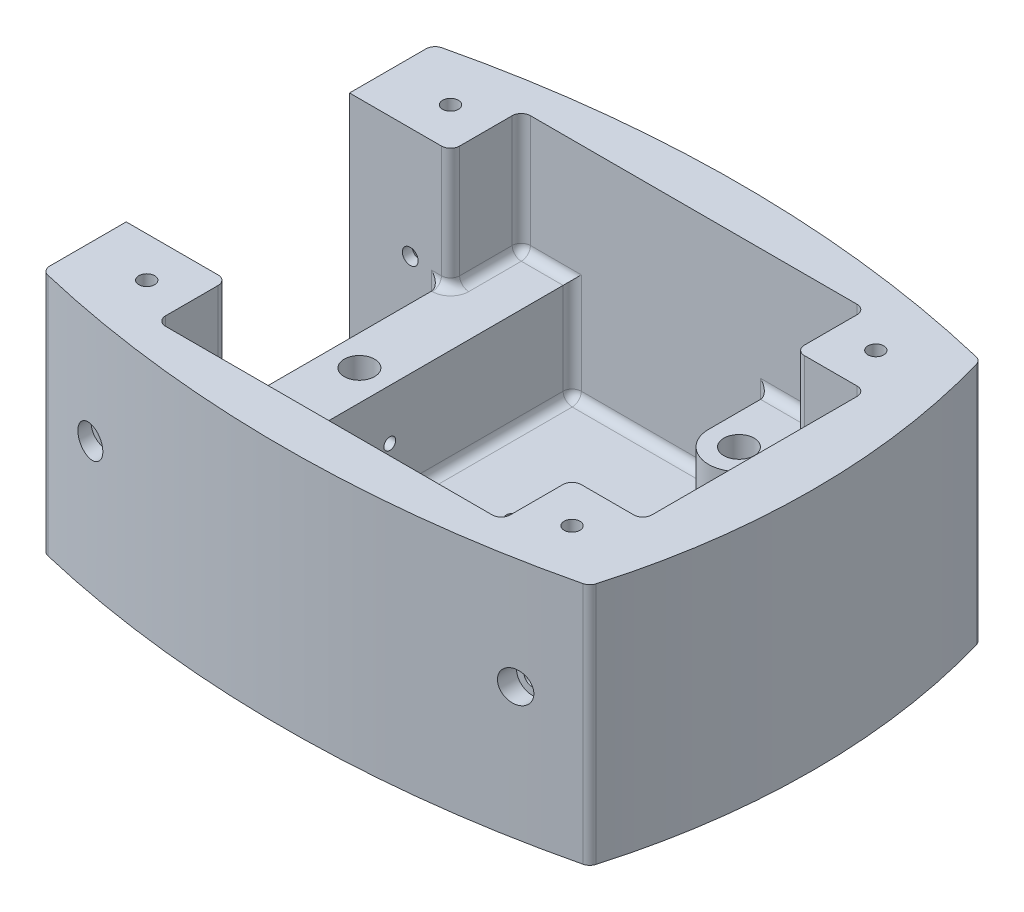
from build123d import *

# Parameters (mm, degrees)
SKETCH1_W            = 20.1
SKETCH1_H            = 20.1
BOSS_EXTRUDE1_DEPTH  = 80
SKETCH1_7_R          = 5
SKETCH1_7_R_2        = 1.6
SKETCH1_7_R_3        = 14
BOSS_EXTRUDE9_DEPTH  = 6.825
SKETCH2_R            = 5.05
CUT_EXTRUDE1_DEPTH   = 62
SKETCH2_3_R          = 5.05
SKETCH2_3_R_2        = 2.6
BOSS_EXTRUDE5_DEPTH  = 26.5
SKETCH2_4_R          = 5.05
SKETCH2_4_R_2        = 2.6
CUT_EXTRUDE2_DEPTH   = 23.3
SKETCH2_5_R          = 5.05
SKETCH2_5_R_2        = 2.6
BOSS_EXTRUDE6_DEPTH  = 3.2
CUT_EXTRUDE3_START   = 127.2
SKETCH2_6_R          = 5.05
CUT_EXTRUDE3_DEPTH   = 127.2
BOSS_EXTRUDE7_START  = 100
SKETCH2_7_R          = 5.05
SKETCH2_7_R_2        = 2.6
BOSS_EXTRUDE7_DEPTH  = 100
CUT_EXTRUDE4_START   = 96.8
SKETCH2_8_R          = 5.05
SKETCH2_8_R_2        = 2.6
CUT_EXTRUDE4_DEPTH   = 96.8
BOSS_EXTRUDE8_START  = 76.7
SKETCH2_9_R          = 5.05
SKETCH2_9_R_2        = 2.6
BOSS_EXTRUDE8_DEPTH  = 76.7
CUT_EXTRUDE5_START   = 73.5
SKETCH2_10_R         = 5.05
SKETCH2_10_R_2       = 2.6
CUT_EXTRUDE5_DEPTH   = 73.5
SKETCH1_9_W          = 20.1
SKETCH1_9_H          = 20.1
SKETCH1_9_R          = 2.6
BOSS_EXTRUDE10_DEPTH = 80
SKETCH1_10_W         = 20.1
SKETCH1_10_H         = 20.1
CUT_EXTRUDE7_DEPTH   = 61.9
SKETCH1_11_R         = 5
BOSS_EXTRUDE11_DEPTH = 40
SKETCH3_R            = 1.95
CUT_EXTRUDE10_DEPTH  = 20
SKETCH3_3_R          = 1.95
CUT_EXTRUDE11_DEPTH  = 118
FILLET1_R            = 3
SKETCH4_R            = 1.5
CUT_EXTRUDE12_DEPTH  = 10


with BuildPart() as part:
    # Sketch1 → Boss-Extrude1 (new body)
    with BuildSketch(Plane(origin=(0, 0, 0), x_dir=(1, 0, 0), z_dir=(0, 1, 0))):
        with BuildLine():
            Line((-126.75, -13.25), (-126.75, 10.05))
            Line((-126.75, 10.05), (-110, 10.05))
            Line((-110, 10.05), (-45, 10.05))
            Line((-45, 10.05), (-25, 10.05))
            Line((-25, 10.05), (-13.25, 10.05))
            Line((-13.25, 10.05), (-13.25, -13.25))
            Line((-13.25, -13.25), (10.05, -13.25))
            Line((10.05, -13.25), (10.05, -86.75))
            Line((10.05, -86.75), (-13.25, -86.75))
            Line((-13.25, -86.75), (-13.25, -110.05))
            Line((-13.25, -110.05), (-25, -110.05))
            Line((-25, -110.05), (-45, -110.05))
            Line((-45, -110.05), (-110, -110.05))
            Line((-110, -110.05), (-126.75, -110.05))
            Line((-126.75, -110.05), (-126.75, -86.75))
            Line((-126.75, -86.75), (-130, -86.75))
            Line((-130, -86.75), (-150.05, -86.75))
            Line((-150.05, -86.75), (-160, -86.75))
            Line((-160, -86.75), (-160, -114.285714286))
            ThreePointArc((-160, -114.285714286), (-70, -125.097415446), (20, -114.285714286))
            ThreePointArc((20, -114.285714286), (29.379159313, -50), (20, 14.285714286))
            ThreePointArc((20, 14.285714286), (-70, 25.097415446), (-160, 14.285714286))
            Line((-160, 14.285714286), (-160, -13.25))
            Line((-160, -13.25), (-150.05, -13.25))
            Line((-150.05, -13.25), (-130, -13.25))
            Line((-130, -13.25), (-126.75, -13.25))
        make_face()
        with Locations((-140, -100)):
            Rectangle(SKETCH1_W, SKETCH1_H, mode=Mode.SUBTRACT)
        with Locations((0, -100)):
            Rectangle(SKETCH1_W, SKETCH1_H, mode=Mode.SUBTRACT)
        with Locations((-140, 0)):
            Rectangle(SKETCH1_W, SKETCH1_H, mode=Mode.SUBTRACT)
        Rectangle(SKETCH1_W, SKETCH1_H, mode=Mode.SUBTRACT)
    extrude(amount=BOSS_EXTRUDE1_DEPTH)

    # Sketch1<7> → Boss-Extrude9 (add)
    with BuildSketch(Plane(origin=(0, 0, 0), x_dir=(1, 0, 0), z_dir=(0, 1, 0))):
        Polygon((-126.75, 10.05), (-126.75, -13.25), (-160, -13.25), (-160, -86.75), (-126.75, -86.75), (-126.75, -110.05), (-13.25, -110.05), (-13.25, -86.75), (10.05, -86.75), (10.05, -13.25), (-13.25, -13.25), (-13.25, 10.05), align=None)
        with Locations(Location((-120, -50, 0), (0, 0, 270))):
            Circle(SKETCH1_7_R, mode=Mode.SUBTRACT)
        with Locations(Location((-54.5, -34.5, 0), (0, 0, 270))):
            Circle(SKETCH1_7_R_2, mode=Mode.SUBTRACT)
        with Locations(Location((-85.5, -65.5, 0), (0, 0, 270))):
            Circle(SKETCH1_7_R_2, mode=Mode.SUBTRACT)
        with Locations(Location((-70, -50, 0), (0, 0, 270))):
            Circle(SKETCH1_7_R_3, mode=Mode.SUBTRACT)
        with Locations(Location((-54.5, -65.5, 0), (0, 0, 270))):
            Circle(SKETCH1_7_R_2, mode=Mode.SUBTRACT)
        with Locations(Location((-85.5, -34.5, 0), (0, 0, 270))):
            Circle(SKETCH1_7_R_2, mode=Mode.SUBTRACT)
        with Locations(Location((-35, -10.05, 0), (0, 0, 270))):
            Circle(SKETCH1_7_R, mode=Mode.SUBTRACT)
        with Locations(Location((-35, -89.95, 0), (0, 0, 270))):
            Circle(SKETCH1_7_R, mode=Mode.SUBTRACT)
    extrude(amount=BOSS_EXTRUDE9_DEPTH)

    # Sketch2 → Cut-Extrude1 (cut)
    with BuildSketch(Plane.XY.offset(13.25)):
        with Locations((0, 43.4125)):
            Circle(SKETCH2_R)
        with Locations((-140, 43.4125)):
            Circle(SKETCH2_R)
    extrude(amount=-CUT_EXTRUDE1_DEPTH, mode=Mode.SUBTRACT)

    # Sketch2<3> → Boss-Extrude5 (add)
    # profile 1 of 2: a face of its own
    with BuildSketch(Plane.XY.offset(13.25)):
        with Locations((0, 43.4125)):
            Circle(SKETCH2_3_R)
        with Locations((0, 43.4125)):
            Circle(SKETCH2_3_R_2, mode=Mode.SUBTRACT)
    # profile 2 of 2: a face of its own
    with BuildSketch(Plane.XY.offset(13.25)):
        with Locations((-140, 43.4125)):
            Circle(SKETCH2_3_R)
        with Locations((-140, 43.4125)):
            Circle(SKETCH2_3_R_2, mode=Mode.SUBTRACT)
    extrude(amount=-BOSS_EXTRUDE5_DEPTH)

    # Sketch2<4> → Cut-Extrude2 (cut)
    # profile 1 of 2: a face of its own
    with BuildSketch(Plane.XY.offset(13.25)):
        with Locations((0, 43.4125)):
            Circle(SKETCH2_4_R)
        with Locations((0, 43.4125)):
            Circle(SKETCH2_4_R_2, mode=Mode.SUBTRACT)
    # profile 2 of 2: a face of its own
    with BuildSketch(Plane.XY.offset(13.25)):
        with Locations((-140, 43.4125)):
            Circle(SKETCH2_4_R)
        with Locations((-140, 43.4125)):
            Circle(SKETCH2_4_R_2, mode=Mode.SUBTRACT)
    extrude(amount=-CUT_EXTRUDE2_DEPTH, mode=Mode.SUBTRACT)

    # Sketch2<5> → Boss-Extrude6 (add)
    # profile 1 of 2: a face of its own
    with BuildSketch(Plane.XY.offset(13.25)):
        with Locations((0, 43.4125)):
            Circle(SKETCH2_5_R)
        with Locations((0, 43.4125)):
            Circle(SKETCH2_5_R_2, mode=Mode.SUBTRACT)
    # profile 2 of 2: a face of its own
    with BuildSketch(Plane.XY.offset(13.25)):
        with Locations((-140, 43.4125)):
            Circle(SKETCH2_5_R)
        with Locations((-140, 43.4125)):
            Circle(SKETCH2_5_R_2, mode=Mode.SUBTRACT)
    extrude(amount=-BOSS_EXTRUDE6_DEPTH)

    # Sketch2<6> → Cut-Extrude3 (cut)
    with BuildSketch(Plane.XY.offset(13.25).offset(CUT_EXTRUDE3_START)):
        with Locations((0, 43.4125)):
            Circle(SKETCH2_6_R)
        with Locations((-140, 43.4125)):
            Circle(SKETCH2_6_R)
    extrude(amount=-CUT_EXTRUDE3_DEPTH, mode=Mode.SUBTRACT)

    # Sketch2<7> → Boss-Extrude7 (add)
    # profile 1 of 2: a face of its own
    with BuildSketch(Plane.XY.offset(13.25).offset(BOSS_EXTRUDE7_START)):
        with Locations((0, 43.4125)):
            Circle(SKETCH2_7_R)
        with Locations((0, 43.4125)):
            Circle(SKETCH2_7_R_2, mode=Mode.SUBTRACT)
    # profile 2 of 2: a face of its own
    with BuildSketch(Plane.XY.offset(13.25).offset(BOSS_EXTRUDE7_START)):
        with Locations((-140, 43.4125)):
            Circle(SKETCH2_7_R)
        with Locations((-140, 43.4125)):
            Circle(SKETCH2_7_R_2, mode=Mode.SUBTRACT)
    extrude(amount=-BOSS_EXTRUDE7_DEPTH)

    # Sketch2<8> → Cut-Extrude4 (cut)
    # profile 1 of 2: a face of its own
    with BuildSketch(Plane.XY.offset(13.25).offset(CUT_EXTRUDE4_START)):
        with Locations((0, 43.4125)):
            Circle(SKETCH2_8_R)
        with Locations((0, 43.4125)):
            Circle(SKETCH2_8_R_2, mode=Mode.SUBTRACT)
    # profile 2 of 2: a face of its own
    with BuildSketch(Plane.XY.offset(13.25).offset(CUT_EXTRUDE4_START)):
        with Locations((-140, 43.4125)):
            Circle(SKETCH2_8_R)
        with Locations((-140, 43.4125)):
            Circle(SKETCH2_8_R_2, mode=Mode.SUBTRACT)
    extrude(amount=-CUT_EXTRUDE4_DEPTH, mode=Mode.SUBTRACT)

    # Sketch2<9> → Boss-Extrude8 (add)
    # profile 1 of 2: a face of its own
    with BuildSketch(Plane.XY.offset(13.25).offset(BOSS_EXTRUDE8_START)):
        with Locations((0, 43.4125)):
            Circle(SKETCH2_9_R)
        with Locations(Location((0, 43.4125, 0), (0, 0, 180))):
            Circle(SKETCH2_9_R_2, mode=Mode.SUBTRACT)
    # profile 2 of 2: a face of its own
    with BuildSketch(Plane.XY.offset(13.25).offset(BOSS_EXTRUDE8_START)):
        with Locations((-140, 43.4125)):
            Circle(SKETCH2_9_R)
        with Locations(Location((-140, 43.4125, 0), (0, 0, 180))):
            Circle(SKETCH2_9_R_2, mode=Mode.SUBTRACT)
    extrude(amount=-BOSS_EXTRUDE8_DEPTH)

    # Sketch2<10> → Cut-Extrude5 (cut)
    # profile 1 of 4: a face of its own
    with BuildSketch(Plane.XY.offset(13.25).offset(CUT_EXTRUDE5_START)):
        with Locations((-140, 43.4125)):
            Circle(SKETCH2_10_R)
        with Locations((-140, 43.4125)):
            Circle(SKETCH2_10_R_2, mode=Mode.SUBTRACT)
    # profile 2 of 4: a face of its own
    with BuildSketch(Plane.XY.offset(13.25).offset(CUT_EXTRUDE5_START)):
        with Locations((-140, 43.4125)):
            Circle(SKETCH2_10_R_2)
    # profile 3 of 4: a face of its own
    with BuildSketch(Plane.XY.offset(13.25).offset(CUT_EXTRUDE5_START)):
        with Locations((0, 43.4125)):
            Circle(SKETCH2_10_R)
        with Locations((0, 43.4125)):
            Circle(SKETCH2_10_R_2, mode=Mode.SUBTRACT)
    # profile 4 of 4: a face of its own
    with BuildSketch(Plane.XY.offset(13.25).offset(CUT_EXTRUDE5_START)):
        with Locations((0, 43.4125)):
            Circle(SKETCH2_10_R_2)
    extrude(amount=-CUT_EXTRUDE5_DEPTH, mode=Mode.SUBTRACT)

    # Sketch1<9> → Boss-Extrude10 (add)
    # profile 1 of 4: a face of its own
    with BuildSketch(Plane(origin=(0, 0, 0), x_dir=(1, 0, 0), z_dir=(0, 1, 0))):
        with Locations((-140, 0)):
            Rectangle(SKETCH1_9_W, SKETCH1_9_H)
        with Locations(Location((-140, 0, 0), (0, 0, 270))):
            Circle(SKETCH1_9_R, mode=Mode.SUBTRACT)
    # profile 2 of 4: a face of its own
    with BuildSketch(Plane(origin=(0, 0, 0), x_dir=(1, 0, 0), z_dir=(0, 1, 0))):
        Rectangle(SKETCH1_9_W, SKETCH1_9_H)
        with Locations(Location((0, 0, 0), (0, 0, 270))):
            Circle(SKETCH1_9_R, mode=Mode.SUBTRACT)
    # profile 3 of 4: a face of its own
    with BuildSketch(Plane(origin=(0, 0, 0), x_dir=(1, 0, 0), z_dir=(0, 1, 0))):
        with Locations((-140, -100)):
            Rectangle(SKETCH1_9_W, SKETCH1_9_H)
        with Locations(Location((-140, -100, 0), (0, 0, 270))):
            Circle(SKETCH1_9_R, mode=Mode.SUBTRACT)
    # profile 4 of 4: a face of its own
    with BuildSketch(Plane(origin=(0, 0, 0), x_dir=(1, 0, 0), z_dir=(0, 1, 0))):
        with Locations((0, -100)):
            Rectangle(SKETCH1_9_W, SKETCH1_9_H)
        with Locations(Location((0, -100, 0), (0, 0, 270))):
            Circle(SKETCH1_9_R, mode=Mode.SUBTRACT)
    extrude(amount=BOSS_EXTRUDE10_DEPTH)

    # Sketch1<10> → Cut-Extrude7 (cut)
    with BuildSketch(Plane(origin=(0, 0, 0), x_dir=(1, 0, 0), z_dir=(0, 1, 0))):
        with Locations((-140, -100)):
            Rectangle(SKETCH1_10_W, SKETCH1_10_H)
        with Locations((-140, 0)):
            Rectangle(SKETCH1_10_W, SKETCH1_10_H)
        with Locations((0, -100)):
            Rectangle(SKETCH1_10_W, SKETCH1_10_H)
        Rectangle(SKETCH1_10_W, SKETCH1_10_H)
    extrude(amount=CUT_EXTRUDE7_DEPTH, mode=Mode.SUBTRACT)

    # Sketch1<11> → Boss-Extrude11 (add)
    # profile 1 of 3: a face of its own
    with BuildSketch(Plane(origin=(0, 0, 0), x_dir=(1, 0, 0), z_dir=(0, 1, 0))):
        Polygon((-110, 10.05), (-126.75, 10.05), (-126.75, -13.25), (-130, -13.25), (-130, -86.75), (-126.75, -86.75), (-126.75, -110.05), (-110, -110.05), align=None)
        with Locations(Location((-120, -50, 0), (0, 0, 270))):
            Circle(SKETCH1_11_R, mode=Mode.SUBTRACT)
    # profile 2 of 3: a face of its own
    with BuildSketch(Plane(origin=(0, 0, 0), x_dir=(1, 0, 0), z_dir=(0, 1, 0))):
        with BuildLine():
            Line((-25, 10.05), (-45, 10.05))
            Line((-45, 10.05), (-45, -10.05))
            ThreePointArc((-45, -10.05), (-35, -20.05), (-25, -10.05))
            Line((-25, -10.05), (-25, 10.05))
        make_face()
        with Locations(Location((-35, -10.05, 0), (0, 0, 270))):
            Circle(SKETCH1_11_R, mode=Mode.SUBTRACT)
    # profile 3 of 3: a face of its own
    with BuildSketch(Plane(origin=(0, 0, 0), x_dir=(1, 0, 0), z_dir=(0, 1, 0))):
        with BuildLine():
            Line((-45, -89.95), (-45, -110.05))
            Line((-45, -110.05), (-25, -110.05))
            Line((-25, -110.05), (-25, -89.95))
            ThreePointArc((-25, -89.95), (-35, -79.95), (-45, -89.95))
        make_face()
        with Locations(Location((-35, -89.95, 0), (0, 0, 270))):
            Circle(SKETCH1_11_R, mode=Mode.SUBTRACT)
    extrude(amount=BOSS_EXTRUDE11_DEPTH)

    # Sketch3 → Cut-Extrude10 (cut)
    with BuildSketch(Plane.ZY.offset(45)):
        with Locations((10.05, 23.4125)):
            Circle(SKETCH3_R)
        with Locations((89.95, 23.4125)):
            Circle(SKETCH3_R)
    extrude(amount=-CUT_EXTRUDE10_DEPTH, mode=Mode.SUBTRACT)

    # Sketch3<3> → Cut-Extrude11 (cut)
    with BuildSketch(Plane.ZY.offset(45)):
        with Locations(Location((50, 23.4125, 0), (0, 0, 180))):
            Circle(SKETCH3_3_R)
    extrude(amount=CUT_EXTRUDE11_DEPTH, mode=Mode.SUBTRACT)

    # Fillet1
    fillet1_edges = [part.edges().sort_by_distance(p)[0] for p in [
        (10.05, 6.825, 50),
        (-1.6, 6.825, 13.25),
        (-13.25, 6.825, 1.6),
        (-13.25, 6.825, 98.4),
        (-1.6, 6.825, 86.75),
        (-145, 6.825, 86.75),
        (-77.5, 6.825, 110.05),
        (-77.5, 6.825, -10.05),
        (-145, 6.825, 13.25),
        (-130, 6.825, 50),
        (-110, 6.825, 50),
        (-110, 23.4125, 110.05),
        (-110, 23.4125, -10.05),
        (-118.375, 40, -10.05),
        (-130, 23.4125, 13.25),
        (-130, 23.4125, 86.75),
        (-126.75, 40, 1.6),
        (-128.375, 40, 13.25),
        (-128.375, 40, 86.75),
        (-126.75, 40, 98.4),
        (-118.375, 40, 110.05),
        (-19.125, 6.825, -10.05),
        (-25, 6.825, 0),
        (-35, 6.825, 20.05),
        (-45, 6.825, 0),
        (-45, 23.4125, -10.05),
        (-25, 23.4125, -10.05),
        (-35, 40, -10.05),
        (-19.125, 6.825, 110.05),
        (-45, 6.825, 100),
        (-35, 6.825, 79.95),
        (-25, 6.825, 100),
        (-25, 23.4125, 110.05),
        (-45, 23.4125, 110.05),
        (-35, 40, 110.05),
        (20, 40, 114.285714286),
        (-160, 40, 114.285714286),
        (-126.75, 60, 86.75),
        (-126.75, 60, 110.05),
        (-13.25, 43.4125, 110.05),
        (-13.25, 43.4125, 86.75),
        (10.05, 43.4125, 86.75),
        (10.05, 43.4125, 13.25),
        (-13.25, 43.4125, 13.25),
        (-13.25, 43.4125, -10.05),
        (-126.75, 60, -10.05),
        (-126.75, 60, 13.25),
        (-160, 40, -14.285714286),
        (20, 40, -14.285714286),
    ]]
    fillet(fillet1_edges, radius=FILLET1_R)

    # Sketch4 → Cut-Extrude12 (cut)
    with BuildSketch(Plane.ZY.offset(-10.05)):
        with Locations((22, 65)):
            Circle(SKETCH4_R)
        with Locations((78, 65)):
            Circle(SKETCH4_R)
        with Locations((78, 29.2)):
            Circle(SKETCH4_R)
        with Locations((22, 29.2)):
            Circle(SKETCH4_R)
    extrude(amount=-CUT_EXTRUDE12_DEPTH, mode=Mode.SUBTRACT)


solid = part.part
